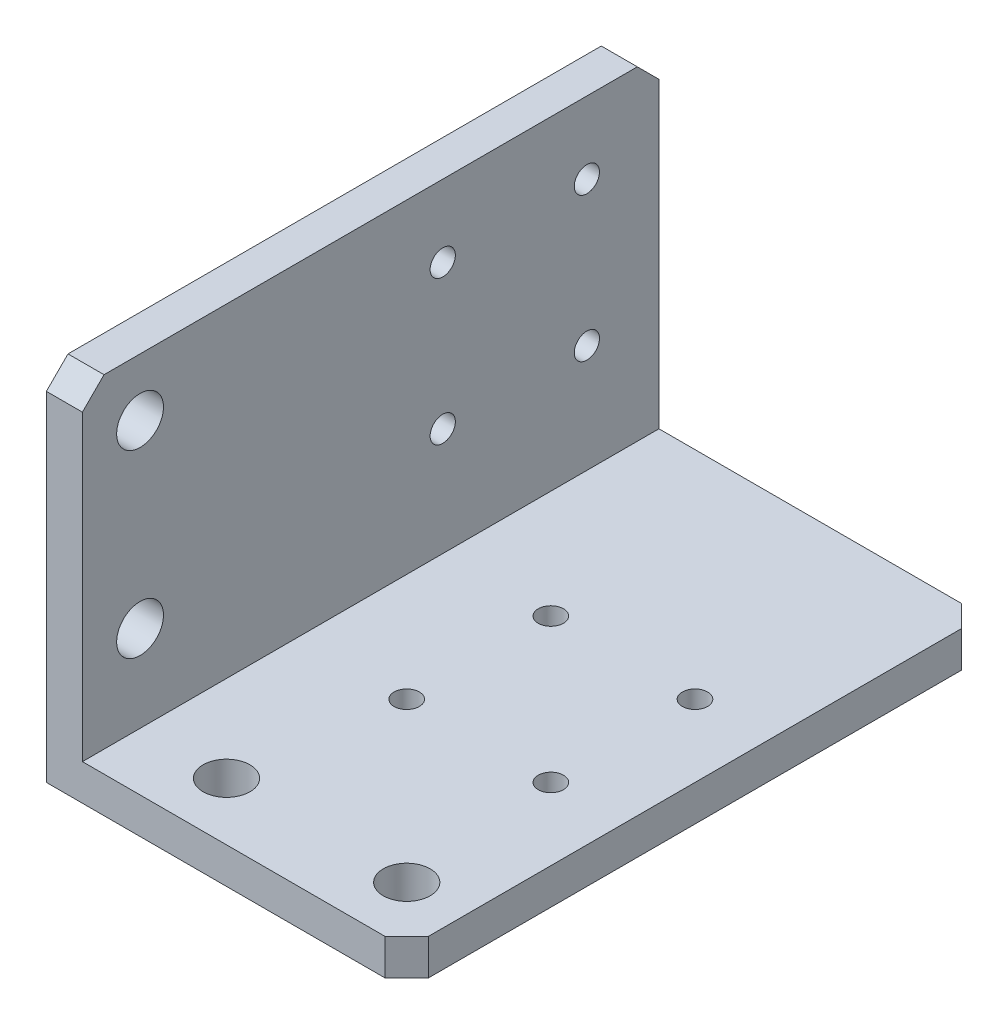
from build123d import *

# Parameters (mm, degrees)
ESTRUSIONE_ESTRUSIONE1_DEPTH = 80
FORO_6_5_6_5_1_D             = 6.5
FORO_6_5_6_5_2_D             = 6.5
FORO_6_5_6_5_2_DEPTH         = 5
FORO_6_5_6_5_2_TIP           = 1.952797012
TAGLIO_ESTRUSIONE3_REACH     = 108.771
SCHIZZO10_R                  = 1.75
TAGLIO_ESTRUSIONE4_REACH     = 108.771
SCHIZZO11_R                  = 1.75
SMUSSO1_SIZE                 = 3


with BuildPart() as part:
    # Schizzo1 → Estrusione-Estrusione1 (new body)
    with BuildSketch(Plane.XY):
        Polygon((0, 0), (0, 50), (5, 50), (5, 5), (50, 5), (50, 0), align=None)
    extrude(amount=ESTRUSIONE_ESTRUSIONE1_DEPTH)

    # Foro Ø6.5 (6.5)-1 (through all)
    with Locations(Plane(origin=(0, 0, 0), x_dir=(-1, 0, 0), z_dir=(0, -1, 0))):
        with Locations((-17, -72), (-42, -72)):
            Hole(FORO_6_5_6_5_1_D / 2)

    # Foro Ø6.5 (6.5)-2
    with Locations(Plane.ZY):
        with Locations((72, 42), (72, 17)):
            Hole(FORO_6_5_6_5_2_D / 2, depth=FORO_6_5_6_5_2_DEPTH)
            with Locations((0, 0, -(FORO_6_5_6_5_2_DEPTH + FORO_6_5_6_5_2_TIP / 2))):  # 118° drill point
                Cone(0, FORO_6_5_6_5_2_D / 2, FORO_6_5_6_5_2_TIP, mode=Mode.SUBTRACT)

    # Schizzo10 → Taglio-Estrusione3 (cut, up to next)
    with BuildSketch(Plane.ZY, mode=Mode.PRIVATE) as taglio_estrusione3_sk1:
        with Locations((10, 40)):
            Circle(SCHIZZO10_R)
    taglio_estrusione3_tool1 = extrude(taglio_estrusione3_sk1.sketch, amount=-TAGLIO_ESTRUSIONE3_REACH, mode=Mode.PRIVATE) & part.part
    # Schizzo10 → Taglio-Estrusione3 (cut, up to next)
    with BuildSketch(Plane.ZY, mode=Mode.PRIVATE) as taglio_estrusione3_sk2:
        with Locations((30, 40)):
            Circle(SCHIZZO10_R)
    taglio_estrusione3_tool2 = extrude(taglio_estrusione3_sk2.sketch, amount=-TAGLIO_ESTRUSIONE3_REACH, mode=Mode.PRIVATE) & part.part
    # Schizzo10 → Taglio-Estrusione3 (cut, up to next)
    with BuildSketch(Plane.ZY, mode=Mode.PRIVATE) as taglio_estrusione3_sk3:
        with Locations((30, 20)):
            Circle(SCHIZZO10_R)
    taglio_estrusione3_tool3 = extrude(taglio_estrusione3_sk3.sketch, amount=-TAGLIO_ESTRUSIONE3_REACH, mode=Mode.PRIVATE) & part.part
    # Schizzo10 → Taglio-Estrusione3 (cut, up to next)
    with BuildSketch(Plane.ZY, mode=Mode.PRIVATE) as taglio_estrusione3_sk4:
        with Locations((10, 20)):
            Circle(SCHIZZO10_R)
    taglio_estrusione3_tool4 = extrude(taglio_estrusione3_sk4.sketch, amount=-TAGLIO_ESTRUSIONE3_REACH, mode=Mode.PRIVATE) & part.part
    add(taglio_estrusione3_tool1.solids().sort_by_distance((0, 40, 10))[0], mode=Mode.SUBTRACT)
    add(taglio_estrusione3_tool2.solids().sort_by_distance((0, 40, 30))[0], mode=Mode.SUBTRACT)
    add(taglio_estrusione3_tool3.solids().sort_by_distance((0, 20, 30))[0], mode=Mode.SUBTRACT)
    add(taglio_estrusione3_tool4.solids().sort_by_distance((0, 20, 10))[0], mode=Mode.SUBTRACT)

    # Schizzo11 → Taglio-Estrusione4 (cut, up to next)
    with BuildSketch(Plane.XZ, mode=Mode.PRIVATE) as taglio_estrusione4_sk1:
        with Locations((20, 30)):
            Circle(SCHIZZO11_R)
    taglio_estrusione4_tool1 = extrude(taglio_estrusione4_sk1.sketch, amount=-TAGLIO_ESTRUSIONE4_REACH, mode=Mode.PRIVATE) & part.part
    # Schizzo11 → Taglio-Estrusione4 (cut, up to next)
    with BuildSketch(Plane.XZ, mode=Mode.PRIVATE) as taglio_estrusione4_sk2:
        with Locations((20, 50)):
            Circle(SCHIZZO11_R)
    taglio_estrusione4_tool2 = extrude(taglio_estrusione4_sk2.sketch, amount=-TAGLIO_ESTRUSIONE4_REACH, mode=Mode.PRIVATE) & part.part
    # Schizzo11 → Taglio-Estrusione4 (cut, up to next)
    with BuildSketch(Plane.XZ, mode=Mode.PRIVATE) as taglio_estrusione4_sk3:
        with Locations((40, 50)):
            Circle(SCHIZZO11_R)
    taglio_estrusione4_tool3 = extrude(taglio_estrusione4_sk3.sketch, amount=-TAGLIO_ESTRUSIONE4_REACH, mode=Mode.PRIVATE) & part.part
    # Schizzo11 → Taglio-Estrusione4 (cut, up to next)
    with BuildSketch(Plane.XZ, mode=Mode.PRIVATE) as taglio_estrusione4_sk4:
        with Locations((40, 30)):
            Circle(SCHIZZO11_R)
    taglio_estrusione4_tool4 = extrude(taglio_estrusione4_sk4.sketch, amount=-TAGLIO_ESTRUSIONE4_REACH, mode=Mode.PRIVATE) & part.part
    add(taglio_estrusione4_tool1.solids().sort_by_distance((20, 0, 30))[0], mode=Mode.SUBTRACT)
    add(taglio_estrusione4_tool2.solids().sort_by_distance((20, 0, 50))[0], mode=Mode.SUBTRACT)
    add(taglio_estrusione4_tool3.solids().sort_by_distance((40, 0, 50))[0], mode=Mode.SUBTRACT)
    add(taglio_estrusione4_tool4.solids().sort_by_distance((40, 0, 30))[0], mode=Mode.SUBTRACT)

    # Smusso1
    smusso1_edges = [part.edges().sort_by_distance(p)[0] for p in [
        (2.5, 50, 0),
        (50, 2.5, 0),
        (2.5, 50, 80),
        (50, 2.5, 80),
    ]]
    chamfer(smusso1_edges, length=SMUSSO1_SIZE)


solid = part.part
